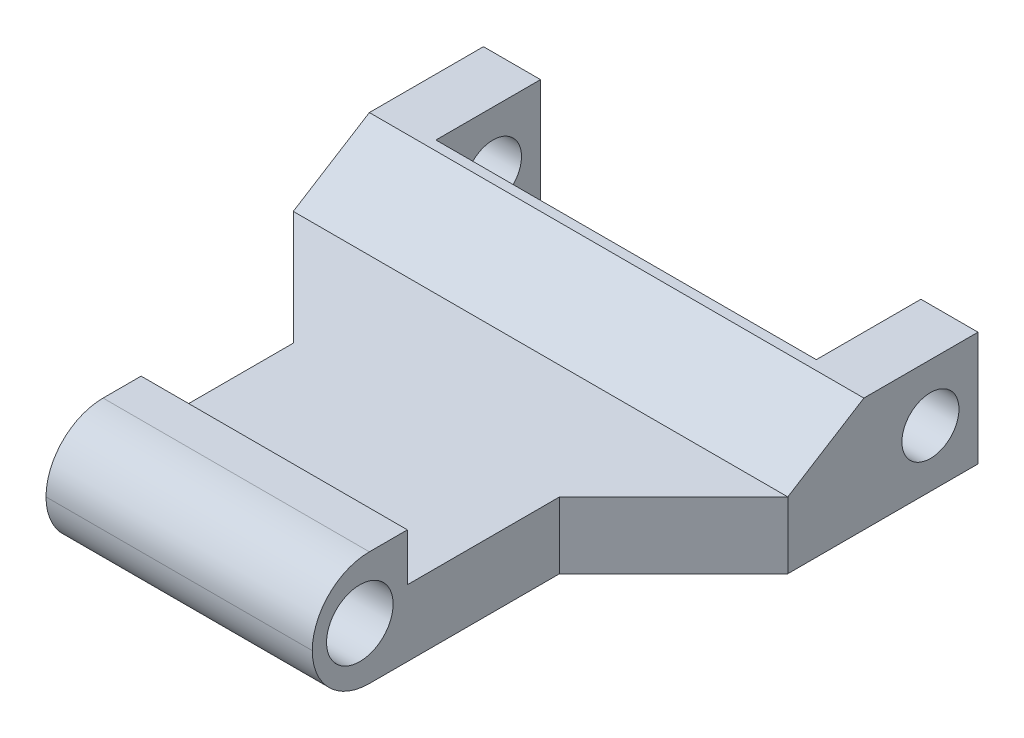
from build123d import *

# Parameters (mm, degrees)
RESSALTO_EXTRUS_O1_DEPTH = 6
CORTE_EXTRUS_O1_DEPTH    = 33.58872513
ESBO_O5_R                = 1.75
CORTE_EXTRUS_O2_DEPTH    = 29.036137494
FILETE1_R                = 3
ESBO_O6_W                = 20
ESBO_O6_H                = 5.5
CORTE_EXTRUS_O3_DEPTH    = 24.558968686
ESBO_O7_R                = 1.5
CORTE_EXTRUS_O4_DEPTH    = 33.58872513


with BuildPart() as part:
    # Esboço1 → Ressalto-extrusão1 (new body)
    with BuildSketch(Plane(origin=(0, 0, 0), x_dir=(1, 0, 0), z_dir=(0, 1, 0))):
        Polygon((7, -10.291044776), (-7, -10.291044776), (-7, 2.708955224), (-13, 8.708955224), (-13, 18.708955224), (13, 18.708955224), (13, 8.708955224), (7, 2.708955224), align=None)
    extrude(amount=RESSALTO_EXTRUS_O1_DEPTH)

    # Esboço4 → Corte-extrusão1 (cut, through all)
    with BuildSketch(Plane.ZY.offset(13)):
        Polygon((-12.708955224, 6), (-8.708955224, 3.5), (5.291044776, 3.5), (5.291044776, 13.308893529), (-12.708955224, 13.308893529), align=None)
    extrude(amount=-CORTE_EXTRUS_O1_DEPTH, mode=Mode.SUBTRACT)

    # Esboço5 → Corte-extrusão2 (cut, through all)
    with BuildSketch(Plane.ZY.offset(7)):
        with Locations((7.791044776, 3)):
            Circle(ESBO_O5_R)
    extrude(amount=-CORTE_EXTRUS_O2_DEPTH, mode=Mode.SUBTRACT)

    # Filete1
    filete1_edges = [part.edges().sort_by_distance(p)[0] for p in [
        (0, 0, 10.291044776),
        (0, 6, 10.291044776),
    ]]
    fillet(filete1_edges, radius=FILETE1_R - 0.0001)  # a hair under: the kernel refuses the full size

    # Esboço6 → Corte-extrusão3 (cut, through all)
    with BuildSketch(Plane(origin=(0, 6, 0), x_dir=(1, 0, 0), z_dir=(0, 1, 0))):
        with Locations((0, 15.958955224)):
            Rectangle(ESBO_O6_W, ESBO_O6_H)
    extrude(amount=-CORTE_EXTRUS_O3_DEPTH, mode=Mode.SUBTRACT)

    # Esboço7 → Corte-extrusão4 (cut, through all)
    with BuildSketch(Plane.ZY.offset(13)):
        with Locations((-16.208955224, 3)):
            Circle(ESBO_O7_R)
    extrude(amount=-CORTE_EXTRUS_O4_DEPTH, mode=Mode.SUBTRACT)


solid = part.part
